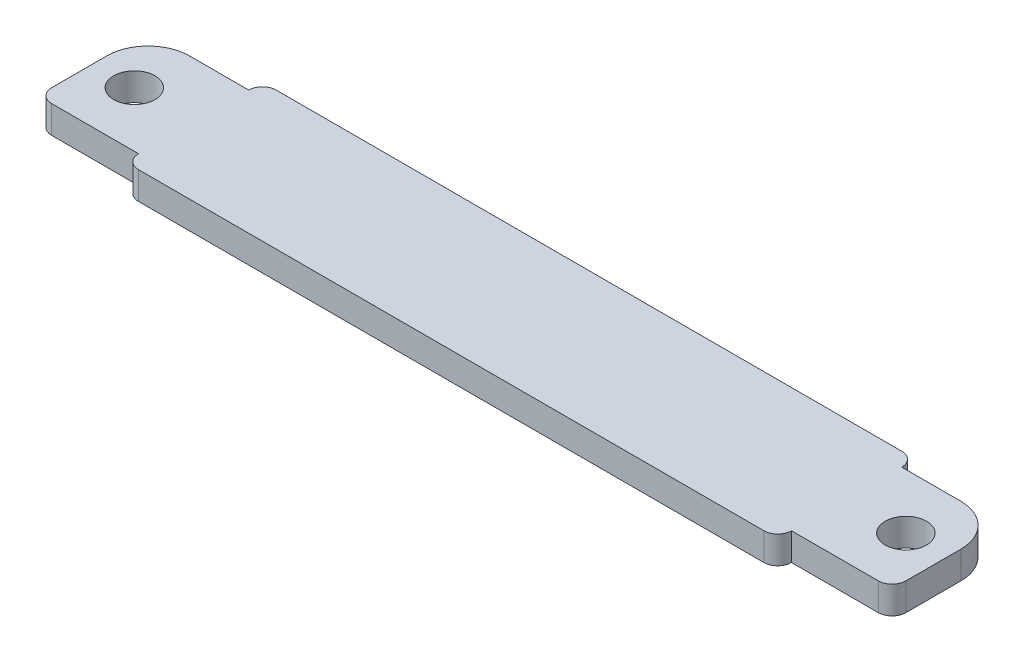
from build123d import *

# Parameters (mm, degrees)
SKETCH1_R           = 1.5
BOSS_EXTRUDE1_DEPTH = 2
FILLET1_R           = 3
FILLET2_R           = 1


with BuildPart() as part:
    # Sketch1 → Boss-Extrude1 (new body)
    with BuildSketch(Plane(origin=(0, 0, 0), x_dir=(1, 0, 0), z_dir=(0, 1, 0))):
        Polygon((-23.75, 5), (23.65, 5), (23.65, 4), (30.95, 4), (30.95, -4), (23.65, -4), (23.65, -5), (-23.75, -5), (-23.75, -4), (-31.05, -4), (-31.05, 4), (-23.75, 4), align=None)
        with Locations(Location((-28.05, 0, 0), (0, 0, 270))):
            Circle(SKETCH1_R, mode=Mode.SUBTRACT)
        with Locations(Location((27.95, 0, 0), (0, 0, 270))):
            Circle(SKETCH1_R, mode=Mode.SUBTRACT)
    extrude(amount=BOSS_EXTRUDE1_DEPTH)

    # Fillet1
    fillet1_edges = [part.edges().sort_by_distance(p)[0] for p in [
        (-31.05, 1, -4),
        (30.95, 1, -4),
    ]]
    fillet(fillet1_edges, radius=FILLET1_R)

    # Fillet2
    fillet2_edges = [part.edges().sort_by_distance(p)[0] for p in [
        (-23.75, 1, 5),
        (23.65, 1, 5),
        (23.65, 1, -5),
        (-23.75, 1, -5),
        (-31.05, 1, 4),
        (30.95, 1, 4),
    ]]
    fillet(fillet2_edges, radius=FILLET2_R - 0.0001)  # a hair under: the kernel refuses the full size


solid = part.part
